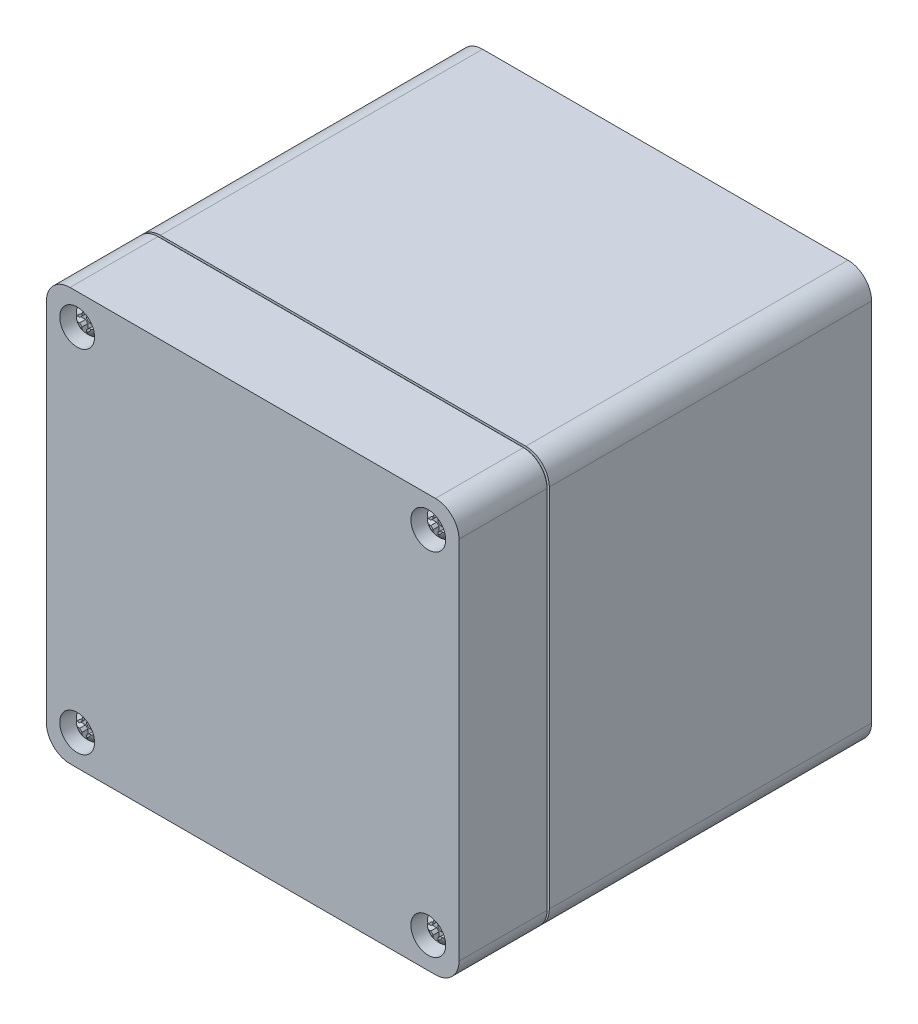
from build123d import *
from OCP.BRepFilletAPI import BRepFilletAPI_MakeChamfer

# Parameters (mm, degrees)
SKETCH3_W                    = 88.9
SKETCH3_H                    = 88.9
BOSS_EXTRUDE1_DEPTH          = 73.8886
CUT_EXTRUDE1_DEPTH           = 70.88886
FILLET1_R                    = 6.35
FILLET2_R                    = 2.54
SKETCH5_W                    = 88.9
SKETCH5_H                    = 88.9
CUT_EXTRUDE2_DEPTH           = 3.45186
SKETCH6_R                    = 2.804922
CUT_EXTRUDE3_DEPTH           = 95.408364787
CUT_EXTRUDE3_DRAFT           = 0.5
CUT_EXTRUDE3_PROFILE_2_DEPTH = 95.408364787
CUT_EXTRUDE3_PROFILE_2_DRAFT = 0.5
CUT_EXTRUDE3_PROFILE_3_DEPTH = 95.408364787
CUT_EXTRUDE3_PROFILE_3_DRAFT = 0.5
CUT_EXTRUDE3_PROFILE_4_DEPTH = 95.408364787
CUT_EXTRUDE3_PROFILE_4_DRAFT = 0.5
SKETCH9_R                    = 4.24942
CUT_EXTRUDE5_DEPTH           = 62.43574
CUT_EXTRUDE5_DRAFT           = -0.5
CUT_EXTRUDE5_PROFILE_2_DEPTH = 62.43574
CUT_EXTRUDE5_PROFILE_2_DRAFT = -0.5
CUT_EXTRUDE5_PROFILE_3_DEPTH = 62.43574
CUT_EXTRUDE5_PROFILE_3_DRAFT = -0.5
CUT_EXTRUDE5_PROFILE_4_DEPTH = 62.43574
CUT_EXTRUDE5_PROFILE_4_DRAFT = -0.5
SKETCH11_R                   = 1.6256
CUT_EXTRUDE6_DEPTH           = 95.408364787
CUT_EXTRUDE7_DEPTH           = 1.27
CHAMFER1_SIZE                = 0.508
FILLET5_R                    = 1.016
LPATTERN1_COUNT              = 2
LPATTERN1_PITCH              = 75.65644
LPATTERN1_2_COUNT            = 2
LPATTERN1_2_PITCH            = 75.65644
CUT_EXTRUDE8_DEPTH           = 67.437
SKETCH15_R                   = 1.5875
CUT_EXTRUDE9_DEPTH           = 106.190107314
MIRROR2_COPY_1_DEPTH         = 67.437
MIRROR2_COPY_2_SKETCH_R      = 1.5875
MIRROR2_COPY_2_DEPTH         = 106.190107314
SKETCH16_W                   = 88.9
SKETCH16_H                   = 88.9
SKETCH16_W_2                 = 87.95004
SKETCH16_H_2                 = 87.95004
CUT_EXTRUDE11_DEPTH          = 1.00076
FILLET3_R                    = 5.08
BOSS_EXTRUDE2_DEPTH          = 19.46402
CUT_EXTRUDE12_DEPTH          = 98.010979842
CUT_EXTRUDE12_DEPTH_BACK     = 98.010979842
SKETCH18_R                   = 1.75006
SKETCH19_R                   = 3.75031
CUT_EXTRUDE13_DEPTH          = 4.74726
CUT_EXTRUDE14_OUTLINE_R      = 1.75006
CUT_EXTRUDE14_DEPTH          = 13.70076
CUT_EXTRUDE14_TAPER          = -1
CUT_EXTRUDE14_2_OUTLINE_R    = 1.75006
CUT_EXTRUDE14_2_DEPTH        = 13.70076
CUT_EXTRUDE14_2_TAPER        = -1
CUT_EXTRUDE14_3_OUTLINE_R    = 1.75006
CUT_EXTRUDE14_3_DEPTH        = 13.70076
CUT_EXTRUDE14_3_TAPER        = -1
CUT_EXTRUDE14_4_OUTLINE_R    = 1.75006
CUT_EXTRUDE14_4_DEPTH        = 13.70076
CUT_EXTRUDE14_4_TAPER        = -1
CUT_EXTRUDE15_DEPTH          = 16.46428
CUT_EXTRUDE17_DEPTH          = 0.508
CUT_EXTRUDE18_DEPTH          = 15.95628
FILLET4_R                    = 0.508
CHAMFER2_SIZE                = 3.048
CHAMFER2_SIZE2               = 0.106438505
CHAMFER3_SIZE                = 3.048
CHAMFER3_SIZE2               = 0.106438505
SKETCH44_R                   = 7
CUT_EXTRUDE24_DEPTH          = 2.99974
SKETCH45_R                   = 2.5
BOSS_EXTRUDE5_DEPTH          = 45.40052
BOSS_EXTRUDE5_2_DEPTH        = 45.40052


with BuildPart() as part:
    # Sketch3 → Boss-Extrude1 (new body)
    with BuildSketch(Plane.XY):
        Rectangle(SKETCH3_W, SKETCH3_H)
    extrude(amount=-BOSS_EXTRUDE1_DEPTH)

    # Sketch4 → Cut-Extrude1 (cut)
    with BuildSketch(Plane.XY):
        Polygon((-41.45026, 21.95068), (-31.75, 21.95068), (-31.75, 41.45026), (31.75, 41.45026), (31.75, 21.95068), (41.45026, 21.95068), (41.45026, -21.95068), (31.75, -21.95068), (31.75, -41.45026), (-31.75, -41.45026), (-31.75, -21.95068), (-41.45026, -21.95068), align=None)
    extrude(amount=-CUT_EXTRUDE1_DEPTH, mode=Mode.SUBTRACT)

    # Fillet1
    fillet1_edges = [part.edges().sort_by_distance(p)[0] for p in [
        (-31.75, 21.95068, -35.44443),
        (31.75, 21.95068, -35.44443),
        (31.75, -21.95068, -35.44443),
        (-31.75, -21.95068, -35.44443),
    ]]
    fillet(fillet1_edges, radius=FILLET1_R)

    # Fillet2
    fillet2_edges = [part.edges().sort_by_distance(p)[0] for p in [
        (-41.45026, -21.95068, -35.44443),
        (-41.45026, 21.95068, -35.44443),
        (-31.75, 41.45026, -35.44443),
        (31.75, 41.45026, -35.44443),
        (41.45026, 21.95068, -35.44443),
        (41.45026, -21.95068, -35.44443),
        (31.75, -41.45026, -35.44443),
        (-31.75, -41.45026, -35.44443),
        (-41.45026, 0, -70.88886),
        (-39.77513, 21.95068, -70.88886),
        (0, 41.45026, -70.88886),
        (31.75, 34.87547, -70.88886),
        (41.45026, 0, -70.88886),
        (39.77513, -21.95068, -70.88886),
        (0, -41.45026, -70.88886),
        (-31.75, -34.87547, -70.88886),
        (39.77513, 21.95068, -70.88886),
        (31.75, -34.87547, -70.88886),
        (-39.77513, -21.95068, -70.88886),
        (-31.75, 34.87547, -70.88886),
        (33.609871939, 23.810551939, -70.88886),
        (33.609871939, -23.810551939, -70.88886),
        (-33.609871939, -23.810551939, -70.88886),
        (-33.609871939, 23.810551939, -70.88886),
    ]]
    fillet(fillet2_edges, radius=FILLET2_R)

    # Sketch5 → Cut-Extrude2 (cut)
    with BuildSketch(Plane.XY):
        Rectangle(SKETCH5_W, SKETCH5_H)
        with BuildLine():
            Line((33.24987, 28.30068), (33.24987, 38.91026))
            ThreePointArc((33.24987, 38.91026), (32.066619472, 41.766879472), (29.21, 42.95013))
            Line((29.21, 42.95013), (-29.21, 42.95013))
            ThreePointArc((-29.21, 42.95013), (-32.066619472, 41.766879472), (-33.24987, 38.91026))
            Line((-33.24987, 38.91026), (-33.24987, 28.30068))
            ThreePointArc((-33.24987, 28.30068), (-34.670440187, 24.871120187), (-38.1, 23.45055))
            Line((-38.1, 23.45055), (-38.91026, 23.45055))
            ThreePointArc((-38.91026, 23.45055), (-41.766879472, 22.267299472), (-42.95013, 19.41068))
            Line((-42.95013, 19.41068), (-42.95013, -19.41068))
            ThreePointArc((-42.95013, -19.41068), (-41.766879472, -22.267299472), (-38.91026, -23.45055))
            Line((-38.91026, -23.45055), (-38.1, -23.45055))
            ThreePointArc((-38.1, -23.45055), (-34.670440187, -24.871120187), (-33.24987, -28.30068))
            Line((-33.24987, -28.30068), (-33.24987, -38.91026))
            ThreePointArc((-33.24987, -38.91026), (-32.066619472, -41.766879472), (-29.21, -42.95013))
            Line((-29.21, -42.95013), (29.21, -42.95013))
            ThreePointArc((29.21, -42.95013), (32.066619472, -41.766879472), (33.24987, -38.91026))
            Line((33.24987, -38.91026), (33.24987, -28.30068))
            ThreePointArc((33.24987, -28.30068), (34.670440187, -24.871120187), (38.1, -23.45055))
            Line((38.1, -23.45055), (38.91026, -23.45055))
            ThreePointArc((38.91026, -23.45055), (41.766879472, -22.267299472), (42.95013, -19.41068))
            Line((42.95013, -19.41068), (42.95013, 19.41068))
            ThreePointArc((42.95013, 19.41068), (41.766879472, 22.267299472), (38.91026, 23.45055))
            Line((38.91026, 23.45055), (38.1, 23.45055))
            ThreePointArc((38.1, 23.45055), (34.670440187, 24.871120187), (33.24987, 28.30068))
        make_face(mode=Mode.SUBTRACT)
    extrude(amount=-CUT_EXTRUDE2_DEPTH, mode=Mode.SUBTRACT)


with BuildPart() as cut_extrude3_tool:
    # Sketch6 → Cut-Extrude3 (with draft: the straight prism first)
    with BuildSketch(Plane.XY.offset(-3.45186)):
        with Locations((37.82822, 37.82822)):
            Circle(SKETCH6_R)
    extrude(amount=-CUT_EXTRUDE3_DEPTH)
    # Cut-Extrude3: the draft: its side faces are tilted about the plane it starts from
    cut_extrude3_sides = [cut_extrude3_tool.faces().sort_by_distance(p)[0] for p in [
        (35.023298, 37.82822, -51.156042394),
    ]]
    draft(cut_extrude3_sides, Plane.XY.offset(-3.45186), CUT_EXTRUDE3_DRAFT)


with BuildPart() as part_1:
    add(part.part)

    # Cut-Extrude3: cut by cut_extrude3_tool
    add(cut_extrude3_tool.part, mode=Mode.SUBTRACT)


with BuildPart() as cut_extrude3_profile_2_tool:
    # Sketch6 → Cut-Extrude3 profile 2 (with draft: the straight prism first)
    with BuildSketch(Plane.XY.offset(-3.45186)):
        with Locations((-37.82822, 37.82822)):
            Circle(SKETCH6_R)
    extrude(amount=-CUT_EXTRUDE3_PROFILE_2_DEPTH)
    # Cut-Extrude3 profile 2: the draft: its side faces are tilted about the plane it starts from
    cut_extrude3_profile_2_sides = [cut_extrude3_profile_2_tool.faces().sort_by_distance(p)[0] for p in [
        (-40.633142, 37.82822, -51.156042394),
    ]]
    draft(cut_extrude3_profile_2_sides, Plane.XY.offset(-3.45186), CUT_EXTRUDE3_PROFILE_2_DRAFT)


with BuildPart() as part_2:
    add(part_1.part)

    # Cut-Extrude3 profile 2: cut by cut_extrude3_profile_2_tool
    add(cut_extrude3_profile_2_tool.part, mode=Mode.SUBTRACT)


with BuildPart() as cut_extrude3_profile_3_tool:
    # Sketch6 → Cut-Extrude3 profile 3 (with draft: the straight prism first)
    with BuildSketch(Plane.XY.offset(-3.45186)):
        with Locations((-37.82822, -37.82822)):
            Circle(SKETCH6_R)
    extrude(amount=-CUT_EXTRUDE3_PROFILE_3_DEPTH)
    # Cut-Extrude3 profile 3: the draft: its side faces are tilted about the plane it starts from
    cut_extrude3_profile_3_sides = [cut_extrude3_profile_3_tool.faces().sort_by_distance(p)[0] for p in [
        (-40.633142, -37.82822, -51.156042394),
    ]]
    draft(cut_extrude3_profile_3_sides, Plane.XY.offset(-3.45186), CUT_EXTRUDE3_PROFILE_3_DRAFT)


with BuildPart() as part_3:
    add(part_2.part)

    # Cut-Extrude3 profile 3: cut by cut_extrude3_profile_3_tool
    add(cut_extrude3_profile_3_tool.part, mode=Mode.SUBTRACT)


with BuildPart() as cut_extrude3_profile_4_tool:
    # Sketch6 → Cut-Extrude3 profile 4 (with draft: the straight prism first)
    with BuildSketch(Plane.XY.offset(-3.45186)):
        with Locations((37.82822, -37.82822)):
            Circle(SKETCH6_R)
    extrude(amount=-CUT_EXTRUDE3_PROFILE_4_DEPTH)
    # Cut-Extrude3 profile 4: the draft: its side faces are tilted about the plane it starts from
    cut_extrude3_profile_4_sides = [cut_extrude3_profile_4_tool.faces().sort_by_distance(p)[0] for p in [
        (35.023298, -37.82822, -51.156042394),
    ]]
    draft(cut_extrude3_profile_4_sides, Plane.XY.offset(-3.45186), CUT_EXTRUDE3_PROFILE_4_DRAFT)


with BuildPart() as part_4:
    add(part_3.part)

    # Cut-Extrude3 profile 4: cut by cut_extrude3_profile_4_tool
    add(cut_extrude3_profile_4_tool.part, mode=Mode.SUBTRACT)


with BuildPart() as cut_extrude5_tool:
    # Sketch9 → Cut-Extrude5 (with draft: the straight prism first)
    with BuildSketch(Plane(origin=(0, 0, -73.8886), x_dir=(-1, 0, 0), z_dir=(0, 0, -1))):
        with Locations((-37.82822, 37.82822)):
            Circle(SKETCH9_R)
    extrude(amount=-CUT_EXTRUDE5_DEPTH)
    # Cut-Extrude5: the draft: its side faces are tilted about the plane it starts from
    cut_extrude5_sides = [cut_extrude5_tool.faces().sort_by_distance(p)[0] for p in [
        (42.07764, 37.82822, -42.67073),
    ]]
    draft(cut_extrude5_sides, Plane(origin=(0, 0, -73.8886), x_dir=(-1, 0, 0), z_dir=(0, 0, -1)), CUT_EXTRUDE5_DRAFT)


with BuildPart() as part_5:
    add(part_4.part)

    # Cut-Extrude5: cut by cut_extrude5_tool
    add(cut_extrude5_tool.part, mode=Mode.SUBTRACT)


with BuildPart() as cut_extrude5_profile_2_tool:
    # Sketch9 → Cut-Extrude5 profile 2 (with draft: the straight prism first)
    with BuildSketch(Plane(origin=(0, 0, -73.8886), x_dir=(-1, 0, 0), z_dir=(0, 0, -1))):
        with Locations((37.82822, 37.82822)):
            Circle(SKETCH9_R)
    extrude(amount=-CUT_EXTRUDE5_PROFILE_2_DEPTH)
    # Cut-Extrude5 profile 2: the draft: its side faces are tilted about the plane it starts from
    cut_extrude5_profile_2_sides = [cut_extrude5_profile_2_tool.faces().sort_by_distance(p)[0] for p in [
        (-33.5788, 37.82822, -42.67073),
    ]]
    draft(cut_extrude5_profile_2_sides, Plane(origin=(0, 0, -73.8886), x_dir=(-1, 0, 0), z_dir=(0, 0, -1)), CUT_EXTRUDE5_PROFILE_2_DRAFT)


with BuildPart() as part_6:
    add(part_5.part)

    # Cut-Extrude5 profile 2: cut by cut_extrude5_profile_2_tool
    add(cut_extrude5_profile_2_tool.part, mode=Mode.SUBTRACT)


with BuildPart() as cut_extrude5_profile_3_tool:
    # Sketch9 → Cut-Extrude5 profile 3 (with draft: the straight prism first)
    with BuildSketch(Plane(origin=(0, 0, -73.8886), x_dir=(-1, 0, 0), z_dir=(0, 0, -1))):
        with Locations((37.82822, -37.82822)):
            Circle(SKETCH9_R)
    extrude(amount=-CUT_EXTRUDE5_PROFILE_3_DEPTH)
    # Cut-Extrude5 profile 3: the draft: its side faces are tilted about the plane it starts from
    cut_extrude5_profile_3_sides = [cut_extrude5_profile_3_tool.faces().sort_by_distance(p)[0] for p in [
        (-33.5788, -37.82822, -42.67073),
    ]]
    draft(cut_extrude5_profile_3_sides, Plane(origin=(0, 0, -73.8886), x_dir=(-1, 0, 0), z_dir=(0, 0, -1)), CUT_EXTRUDE5_PROFILE_3_DRAFT)


with BuildPart() as part_7:
    add(part_6.part)

    # Cut-Extrude5 profile 3: cut by cut_extrude5_profile_3_tool
    add(cut_extrude5_profile_3_tool.part, mode=Mode.SUBTRACT)


with BuildPart() as cut_extrude5_profile_4_tool:
    # Sketch9 → Cut-Extrude5 profile 4 (with draft: the straight prism first)
    with BuildSketch(Plane(origin=(0, 0, -73.8886), x_dir=(-1, 0, 0), z_dir=(0, 0, -1))):
        with Locations((-37.82822, -37.82822)):
            Circle(SKETCH9_R)
    extrude(amount=-CUT_EXTRUDE5_PROFILE_4_DEPTH)
    # Cut-Extrude5 profile 4: the draft: its side faces are tilted about the plane it starts from
    cut_extrude5_profile_4_sides = [cut_extrude5_profile_4_tool.faces().sort_by_distance(p)[0] for p in [
        (42.07764, -37.82822, -42.67073),
    ]]
    draft(cut_extrude5_profile_4_sides, Plane(origin=(0, 0, -73.8886), x_dir=(-1, 0, 0), z_dir=(0, 0, -1)), CUT_EXTRUDE5_PROFILE_4_DRAFT)


with BuildPart() as part_8:
    add(part_7.part)

    # Cut-Extrude5 profile 4: cut by cut_extrude5_profile_4_tool
    add(cut_extrude5_profile_4_tool.part, mode=Mode.SUBTRACT)

    # Sketch14 → Cut-Extrude8 (cut)
    with BuildSketch(Plane.XY.offset(-3.45186)):
        with BuildLine():
            Line((-41.45026, 33.02), (-34.0233, 33.02))
            ThreePointArc((-34.0233, 33.02), (-33.484484633, 32.796815367), (-33.2613, 32.258))
            Line((-33.2613, 32.258), (-33.2613, 29.21))
            ThreePointArc((-33.2613, 29.21), (-34.749197552, 25.617897552), (-38.3413, 24.13))
            Line((-38.3413, 24.13), (-41.45026, 24.13))
            Line((-41.45026, 24.13), (-41.45026, 33.02))
        make_face()
    cut_extrude8 = extrude(amount=-CUT_EXTRUDE8_DEPTH, mode=Mode.SUBTRACT)

    # Sketch15 → Cut-Extrude9 (cut, through all)
    with BuildSketch(Plane.XY.offset(-70.88886)):
        with Locations((-38.1, 28.30068)):
            Circle(SKETCH15_R)
    cut_extrude9 = extrude(amount=-CUT_EXTRUDE9_DEPTH, mode=Mode.SUBTRACT)

    # Mirror1: Cut-Extrude8, Cut-Extrude9 across plane
    add(cut_extrude8.mirror(Plane(origin=(0, 0, 0), x_dir=(0, 0, 1), z_dir=(1, 0, 0))), mode=Mode.SUBTRACT)
    add(cut_extrude9.mirror(Plane(origin=(0, 0, 0), x_dir=(0, 0, 1), z_dir=(1, 0, 0))), mode=Mode.SUBTRACT)

    # Mirror2: Cut-Extrude8, Cut-Extrude9 across plane
    add(cut_extrude8.mirror(Plane.ZX), mode=Mode.SUBTRACT)
    add(cut_extrude9.mirror(Plane.ZX), mode=Mode.SUBTRACT)

    # Mirror2 copy 1 sketch → Mirror2 copy 1 (cut)
    with BuildSketch(Plane(origin=(0, 0, -3.45186), x_dir=(-1, 0, 0), z_dir=(0, 0, 1))):
        with BuildLine():
            Line((-41.45026, 33.02), (-34.0233, 33.02))
            ThreePointArc((-34.0233, 33.02), (-33.484484633, 32.796815367), (-33.2613, 32.258))
            Line((-33.2613, 32.258), (-33.2613, 29.21))
            ThreePointArc((-33.2613, 29.21), (-34.749197552, 25.617897552), (-38.3413, 24.13))
            Line((-38.3413, 24.13), (-41.45026, 24.13))
            Line((-41.45026, 24.13), (-41.45026, 33.02))
        make_face()
    extrude(amount=-MIRROR2_COPY_1_DEPTH, mode=Mode.SUBTRACT)

    # Mirror2 copy 2 sketch → Mirror2 copy 2 (cut, through all)
    with BuildSketch(Plane(origin=(0, 0, -70.88886), x_dir=(-1, 0, 0), z_dir=(0, 0, 1))):
        with Locations((-38.1, 28.30068)):
            Circle(MIRROR2_COPY_2_SKETCH_R)
    extrude(amount=-MIRROR2_COPY_2_DEPTH, mode=Mode.SUBTRACT)

    # Sketch16 → Cut-Extrude11 (cut)
    with BuildSketch(Plane.XY.offset(-3.45186)):
        Rectangle(SKETCH16_W, SKETCH16_H)
        Rectangle(SKETCH16_W_2, SKETCH16_H_2, mode=Mode.SUBTRACT)
    extrude(amount=-CUT_EXTRUDE11_DEPTH, mode=Mode.SUBTRACT)

    # Fillet3
    fillet3_edges = [part_8.edges().sort_by_distance(p)[0] for p in [
        (43.97502, -43.97502, -3.95224),
        (-43.97502, -43.97502, -3.95224),
        (-43.97502, 43.97502, -3.95224),
        (43.97502, 43.97502, -3.95224),
        (-44.45, 44.45, -39.17061),
        (44.45, 44.45, -39.17061),
        (44.45, -44.45, -39.17061),
        (-44.45, -44.45, -39.17061),
    ]]
    fillet(fillet3_edges, radius=FILLET3_R)

    # Chamfer2: one chamfer whose edges measure the first distance from different faces: ONE call of the kernel's chamfer builder (chamfer() names one face for all edges)
    chamfer2_edges_1 = [part_8.edges().sort_by_distance(p)[0] for p in [
        (34.670440187, 24.871120187, 0),
    ]]
    chamfer2_side_1 = [part_8.faces().sort_by_distance(p)[0] for p in [
        (34.670440187, 24.871120187, -1.72593),
    ]]
    chamfer2_edges_2 = [part_8.edges().sort_by_distance(p)[0] for p in [
        (38.50513, 23.45055, 0),
    ]]
    chamfer2_side_2 = [part_8.faces().sort_by_distance(p)[0] for p in [
        (38.50513, 23.45055, -1.72593),
    ]]
    chamfer2_edges_3 = [part_8.edges().sort_by_distance(p)[0] for p in [
        (41.766879472, 22.267299472, 0),
    ]]
    chamfer2_side_3 = [part_8.faces().sort_by_distance(p)[0] for p in [
        (41.766879472, 22.267299472, -1.72593),
    ]]
    chamfer2_edges_4 = [part_8.edges().sort_by_distance(p)[0] for p in [
        (42.95013, 0, 0),
    ]]
    chamfer2_side_4 = [part_8.faces().sort_by_distance(p)[0] for p in [
        (42.95013, 0, -1.72593),
    ]]
    chamfer2_edges_5 = [part_8.edges().sort_by_distance(p)[0] for p in [
        (41.766879472, -22.267299472, 0),
    ]]
    chamfer2_side_5 = [part_8.faces().sort_by_distance(p)[0] for p in [
        (41.766879472, -22.267299472, -1.72593),
    ]]
    chamfer2_edges_6 = [part_8.edges().sort_by_distance(p)[0] for p in [
        (38.50513, -23.45055, 0),
    ]]
    chamfer2_side_6 = [part_8.faces().sort_by_distance(p)[0] for p in [
        (38.50513, -23.45055, -1.72593),
    ]]
    chamfer2_edges_7 = [part_8.edges().sort_by_distance(p)[0] for p in [
        (34.670440187, -24.871120187, 0),
    ]]
    chamfer2_side_7 = [part_8.faces().sort_by_distance(p)[0] for p in [
        (34.670440187, -24.871120187, -1.72593),
    ]]
    chamfer2_edges_8 = [part_8.edges().sort_by_distance(p)[0] for p in [
        (33.24987, -33.60547, 0),
    ]]
    chamfer2_side_8 = [part_8.faces().sort_by_distance(p)[0] for p in [
        (33.24987, -33.60547, -1.72593),
    ]]
    chamfer2_edges_9 = [part_8.edges().sort_by_distance(p)[0] for p in [
        (32.066619472, -41.766879472, 0),
    ]]
    chamfer2_side_9 = [part_8.faces().sort_by_distance(p)[0] for p in [
        (32.066619472, -41.766879472, -1.72593),
    ]]
    chamfer2_edges_10 = [part_8.edges().sort_by_distance(p)[0] for p in [
        (0, -42.95013, 0),
    ]]
    chamfer2_side_10 = [part_8.faces().sort_by_distance(p)[0] for p in [
        (0, -42.95013, -1.72593),
    ]]
    chamfer2_edges_11 = [part_8.edges().sort_by_distance(p)[0] for p in [
        (-32.066619472, -41.766879472, 0),
    ]]
    chamfer2_side_11 = [part_8.faces().sort_by_distance(p)[0] for p in [
        (-32.066619472, -41.766879472, -1.72593),
    ]]
    chamfer2_edges_12 = [part_8.edges().sort_by_distance(p)[0] for p in [
        (-33.24987, -33.60547, 0),
    ]]
    chamfer2_side_12 = [part_8.faces().sort_by_distance(p)[0] for p in [
        (-33.24987, -33.60547, -1.72593),
    ]]
    chamfer2_edges_13 = [part_8.edges().sort_by_distance(p)[0] for p in [
        (-34.670440187, -24.871120187, 0),
    ]]
    chamfer2_side_13 = [part_8.faces().sort_by_distance(p)[0] for p in [
        (-34.670440187, -24.871120187, -1.72593),
    ]]
    chamfer2_edges_14 = [part_8.edges().sort_by_distance(p)[0] for p in [
        (-38.50513, -23.45055, 0),
    ]]
    chamfer2_side_14 = [part_8.faces().sort_by_distance(p)[0] for p in [
        (-38.50513, -23.45055, -1.72593),
    ]]
    chamfer2_edges_15 = [part_8.edges().sort_by_distance(p)[0] for p in [
        (-41.766879472, -22.267299472, 0),
    ]]
    chamfer2_side_15 = [part_8.faces().sort_by_distance(p)[0] for p in [
        (-41.766879472, -22.267299472, -1.72593),
    ]]
    chamfer2_edges_16 = [part_8.edges().sort_by_distance(p)[0] for p in [
        (-42.95013, 0, 0),
    ]]
    chamfer2_side_16 = [part_8.faces().sort_by_distance(p)[0] for p in [
        (-42.95013, 0, -1.72593),
    ]]
    chamfer2_edges_17 = [part_8.edges().sort_by_distance(p)[0] for p in [
        (-41.766879472, 22.267299472, 0),
    ]]
    chamfer2_side_17 = [part_8.faces().sort_by_distance(p)[0] for p in [
        (-41.766879472, 22.267299472, -1.72593),
    ]]
    chamfer2_edges_18 = [part_8.edges().sort_by_distance(p)[0] for p in [
        (-38.50513, 23.45055, 0),
    ]]
    chamfer2_side_18 = [part_8.faces().sort_by_distance(p)[0] for p in [
        (-38.50513, 23.45055, -1.72593),
    ]]
    chamfer2_edges_19 = [part_8.edges().sort_by_distance(p)[0] for p in [
        (-34.670440187, 24.871120187, 0),
    ]]
    chamfer2_side_19 = [part_8.faces().sort_by_distance(p)[0] for p in [
        (-34.670440187, 24.871120187, -1.72593),
    ]]
    chamfer2_edges_20 = [part_8.edges().sort_by_distance(p)[0] for p in [
        (-33.24987, 33.60547, 0),
    ]]
    chamfer2_side_20 = [part_8.faces().sort_by_distance(p)[0] for p in [
        (-33.24987, 33.60547, -1.72593),
    ]]
    chamfer2_edges_21 = [part_8.edges().sort_by_distance(p)[0] for p in [
        (-32.066619472, 41.766879472, 0),
    ]]
    chamfer2_side_21 = [part_8.faces().sort_by_distance(p)[0] for p in [
        (-32.066619472, 41.766879472, -1.72593),
    ]]
    chamfer2_edges_22 = [part_8.edges().sort_by_distance(p)[0] for p in [
        (0, 42.95013, 0),
    ]]
    chamfer2_side_22 = [part_8.faces().sort_by_distance(p)[0] for p in [
        (0, 42.95013, -1.72593),
    ]]
    chamfer2_edges_23 = [part_8.edges().sort_by_distance(p)[0] for p in [
        (32.066619472, 41.766879472, 0),
    ]]
    chamfer2_side_23 = [part_8.faces().sort_by_distance(p)[0] for p in [
        (32.066619472, 41.766879472, -1.72593),
    ]]
    chamfer2_edges_24 = [part_8.edges().sort_by_distance(p)[0] for p in [
        (33.24987, 33.60547, 0),
    ]]
    chamfer2_side_24 = [part_8.faces().sort_by_distance(p)[0] for p in [
        (33.24987, 33.60547, -1.72593),
    ]]
    chamfer2 = BRepFilletAPI_MakeChamfer(part_8.part.solid().wrapped)
    for e in chamfer2_edges_1:
        chamfer2.Add(CHAMFER2_SIZE, CHAMFER2_SIZE2, e.wrapped, chamfer2_side_1[0].wrapped)  # the first distance lies on this face
    for e in chamfer2_edges_2:
        chamfer2.Add(CHAMFER2_SIZE, CHAMFER2_SIZE2, e.wrapped, chamfer2_side_2[0].wrapped)  # the first distance lies on this face
    for e in chamfer2_edges_3:
        chamfer2.Add(CHAMFER2_SIZE, CHAMFER2_SIZE2, e.wrapped, chamfer2_side_3[0].wrapped)  # the first distance lies on this face
    for e in chamfer2_edges_4:
        chamfer2.Add(CHAMFER2_SIZE, CHAMFER2_SIZE2, e.wrapped, chamfer2_side_4[0].wrapped)  # the first distance lies on this face
    for e in chamfer2_edges_5:
        chamfer2.Add(CHAMFER2_SIZE, CHAMFER2_SIZE2, e.wrapped, chamfer2_side_5[0].wrapped)  # the first distance lies on this face
    for e in chamfer2_edges_6:
        chamfer2.Add(CHAMFER2_SIZE, CHAMFER2_SIZE2, e.wrapped, chamfer2_side_6[0].wrapped)  # the first distance lies on this face
    for e in chamfer2_edges_7:
        chamfer2.Add(CHAMFER2_SIZE, CHAMFER2_SIZE2, e.wrapped, chamfer2_side_7[0].wrapped)  # the first distance lies on this face
    for e in chamfer2_edges_8:
        chamfer2.Add(CHAMFER2_SIZE, CHAMFER2_SIZE2, e.wrapped, chamfer2_side_8[0].wrapped)  # the first distance lies on this face
    for e in chamfer2_edges_9:
        chamfer2.Add(CHAMFER2_SIZE, CHAMFER2_SIZE2, e.wrapped, chamfer2_side_9[0].wrapped)  # the first distance lies on this face
    for e in chamfer2_edges_10:
        chamfer2.Add(CHAMFER2_SIZE, CHAMFER2_SIZE2, e.wrapped, chamfer2_side_10[0].wrapped)  # the first distance lies on this face
    for e in chamfer2_edges_11:
        chamfer2.Add(CHAMFER2_SIZE, CHAMFER2_SIZE2, e.wrapped, chamfer2_side_11[0].wrapped)  # the first distance lies on this face
    for e in chamfer2_edges_12:
        chamfer2.Add(CHAMFER2_SIZE, CHAMFER2_SIZE2, e.wrapped, chamfer2_side_12[0].wrapped)  # the first distance lies on this face
    for e in chamfer2_edges_13:
        chamfer2.Add(CHAMFER2_SIZE, CHAMFER2_SIZE2, e.wrapped, chamfer2_side_13[0].wrapped)  # the first distance lies on this face
    for e in chamfer2_edges_14:
        chamfer2.Add(CHAMFER2_SIZE, CHAMFER2_SIZE2, e.wrapped, chamfer2_side_14[0].wrapped)  # the first distance lies on this face
    for e in chamfer2_edges_15:
        chamfer2.Add(CHAMFER2_SIZE, CHAMFER2_SIZE2, e.wrapped, chamfer2_side_15[0].wrapped)  # the first distance lies on this face
    for e in chamfer2_edges_16:
        chamfer2.Add(CHAMFER2_SIZE, CHAMFER2_SIZE2, e.wrapped, chamfer2_side_16[0].wrapped)  # the first distance lies on this face
    for e in chamfer2_edges_17:
        chamfer2.Add(CHAMFER2_SIZE, CHAMFER2_SIZE2, e.wrapped, chamfer2_side_17[0].wrapped)  # the first distance lies on this face
    for e in chamfer2_edges_18:
        chamfer2.Add(CHAMFER2_SIZE, CHAMFER2_SIZE2, e.wrapped, chamfer2_side_18[0].wrapped)  # the first distance lies on this face
    for e in chamfer2_edges_19:
        chamfer2.Add(CHAMFER2_SIZE, CHAMFER2_SIZE2, e.wrapped, chamfer2_side_19[0].wrapped)  # the first distance lies on this face
    for e in chamfer2_edges_20:
        chamfer2.Add(CHAMFER2_SIZE, CHAMFER2_SIZE2, e.wrapped, chamfer2_side_20[0].wrapped)  # the first distance lies on this face
    for e in chamfer2_edges_21:
        chamfer2.Add(CHAMFER2_SIZE, CHAMFER2_SIZE2, e.wrapped, chamfer2_side_21[0].wrapped)  # the first distance lies on this face
    for e in chamfer2_edges_22:
        chamfer2.Add(CHAMFER2_SIZE, CHAMFER2_SIZE2, e.wrapped, chamfer2_side_22[0].wrapped)  # the first distance lies on this face
    for e in chamfer2_edges_23:
        chamfer2.Add(CHAMFER2_SIZE, CHAMFER2_SIZE2, e.wrapped, chamfer2_side_23[0].wrapped)  # the first distance lies on this face
    for e in chamfer2_edges_24:
        chamfer2.Add(CHAMFER2_SIZE, CHAMFER2_SIZE2, e.wrapped, chamfer2_side_24[0].wrapped)  # the first distance lies on this face
    add(Compound.cast(chamfer2.Shape()), mode=Mode.REPLACE)

    # Chamfer3: one chamfer whose edges measure the first distance from different faces: ONE call of the kernel's chamfer builder (chamfer() names one face for all edges)
    chamfer3_edges_1 = [part_8.edges().sort_by_distance(p)[0] for p in [
        (31.006051224, -40.706311224, 0),
    ]]
    chamfer3_side_1 = [part_8.faces().sort_by_distance(p)[0] for p in [
        (31.006051224, -40.706311224, -34.17443),
    ]]
    chamfer3_edges_2 = [part_8.edges().sort_by_distance(p)[0] for p in [
        (-31.006051224, -40.706311224, 0),
    ]]
    chamfer3_side_2 = [part_8.faces().sort_by_distance(p)[0] for p in [
        (-31.006051224, -40.706311224, -34.17443),
    ]]
    chamfer3_edges_3 = [part_8.edges().sort_by_distance(p)[0] for p in [
        (-40.706311224, -21.206731224, 0),
    ]]
    chamfer3_side_3 = [part_8.faces().sort_by_distance(p)[0] for p in [
        (-40.706311224, -21.206731224, -34.17443),
    ]]
    chamfer3_edges_4 = [part_8.edges().sort_by_distance(p)[0] for p in [
        (-40.706311224, 21.206731224, 0),
    ]]
    chamfer3_side_4 = [part_8.faces().sort_by_distance(p)[0] for p in [
        (-40.706311224, 21.206731224, -34.17443),
    ]]
    chamfer3_edges_5 = [part_8.edges().sort_by_distance(p)[0] for p in [
        (-31.006051224, 40.706311224, 0),
    ]]
    chamfer3_side_5 = [part_8.faces().sort_by_distance(p)[0] for p in [
        (-31.006051224, 40.706311224, -34.17443),
    ]]
    chamfer3_edges_6 = [part_8.edges().sort_by_distance(p)[0] for p in [
        (31.006051224, 40.706311224, 0),
    ]]
    chamfer3_side_6 = [part_8.faces().sort_by_distance(p)[0] for p in [
        (31.006051224, 40.706311224, -34.17443),
    ]]
    chamfer3_edges_7 = [part_8.edges().sort_by_distance(p)[0] for p in [
        (40.706311224, 21.206731224, 0),
    ]]
    chamfer3_side_7 = [part_8.faces().sort_by_distance(p)[0] for p in [
        (40.706311224, 21.206731224, -34.17443),
    ]]
    chamfer3_edges_8 = [part_8.edges().sort_by_distance(p)[0] for p in [
        (40.706311224, -21.206731224, 0),
    ]]
    chamfer3_side_8 = [part_8.faces().sort_by_distance(p)[0] for p in [
        (40.706311224, -21.206731224, -34.17443),
    ]]
    chamfer3_edges_9 = [part_8.edges().sort_by_distance(p)[0] for p in [
        (31.75, 33.60547, 0),
    ]]
    chamfer3_side_9 = [part_8.faces().sort_by_distance(p)[0] for p in [
        (31.75, 33.60547, -34.17443),
    ]]
    chamfer3_edges_10 = [part_8.edges().sort_by_distance(p)[0] for p in [
        (-38.50513, 21.95068, 0),
    ]]
    chamfer3_side_10 = [part_8.faces().sort_by_distance(p)[0] for p in [
        (-38.50513, 21.95068, -34.17443),
    ]]
    chamfer3_edges_11 = [part_8.edges().sort_by_distance(p)[0] for p in [
        (38.50513, -21.95068, 0),
    ]]
    chamfer3_side_11 = [part_8.faces().sort_by_distance(p)[0] for p in [
        (38.50513, -21.95068, -34.17443),
    ]]
    chamfer3_edges_12 = [part_8.edges().sort_by_distance(p)[0] for p in [
        (-31.75, -33.60547, 0),
    ]]
    chamfer3_side_12 = [part_8.faces().sort_by_distance(p)[0] for p in [
        (-31.75, -33.60547, -34.17443),
    ]]
    chamfer3_edges_13 = [part_8.edges().sort_by_distance(p)[0] for p in [
        (-33.609871939, 23.810551939, 0),
    ]]
    chamfer3_side_13 = [part_8.faces().sort_by_distance(p)[0] for p in [
        (-33.609871939, 23.810551939, -34.17443),
    ]]
    chamfer3_edges_14 = [part_8.edges().sort_by_distance(p)[0] for p in [
        (-33.609871939, -23.810551939, 0),
    ]]
    chamfer3_side_14 = [part_8.faces().sort_by_distance(p)[0] for p in [
        (-33.609871939, -23.810551939, -34.17443),
    ]]
    chamfer3_edges_15 = [part_8.edges().sort_by_distance(p)[0] for p in [
        (33.609871939, -23.810551939, 0),
    ]]
    chamfer3_side_15 = [part_8.faces().sort_by_distance(p)[0] for p in [
        (33.609871939, -23.810551939, -34.17443),
    ]]
    chamfer3_edges_16 = [part_8.edges().sort_by_distance(p)[0] for p in [
        (33.609871939, 23.810551939, 0),
    ]]
    chamfer3_side_16 = [part_8.faces().sort_by_distance(p)[0] for p in [
        (33.609871939, 23.810551939, -34.17443),
    ]]
    chamfer3_edges_17 = [part_8.edges().sort_by_distance(p)[0] for p in [
        (-31.75, 33.60547, 0),
    ]]
    chamfer3_side_17 = [part_8.faces().sort_by_distance(p)[0] for p in [
        (-31.75, 33.60547, -34.17443),
    ]]
    chamfer3_edges_18 = [part_8.edges().sort_by_distance(p)[0] for p in [
        (0, 41.45026, 0),
    ]]
    chamfer3_side_18 = [part_8.faces().sort_by_distance(p)[0] for p in [
        (0, 41.45026, -34.17443),
    ]]
    chamfer3_edges_19 = [part_8.edges().sort_by_distance(p)[0] for p in [
        (38.50513, 21.95068, 0),
    ]]
    chamfer3_side_19 = [part_8.faces().sort_by_distance(p)[0] for p in [
        (38.50513, 21.95068, -34.17443),
    ]]
    chamfer3_edges_20 = [part_8.edges().sort_by_distance(p)[0] for p in [
        (41.45026, 0, 0),
    ]]
    chamfer3_side_20 = [part_8.faces().sort_by_distance(p)[0] for p in [
        (41.45026, 0, -34.17443),
    ]]
    chamfer3_edges_21 = [part_8.edges().sort_by_distance(p)[0] for p in [
        (31.75, -33.60547, 0),
    ]]
    chamfer3_side_21 = [part_8.faces().sort_by_distance(p)[0] for p in [
        (31.75, -33.60547, -34.17443),
    ]]
    chamfer3_edges_22 = [part_8.edges().sort_by_distance(p)[0] for p in [
        (0, -41.45026, 0),
    ]]
    chamfer3_side_22 = [part_8.faces().sort_by_distance(p)[0] for p in [
        (0, -41.45026, -34.17443),
    ]]
    chamfer3_edges_23 = [part_8.edges().sort_by_distance(p)[0] for p in [
        (-38.50513, -21.95068, 0),
    ]]
    chamfer3_side_23 = [part_8.faces().sort_by_distance(p)[0] for p in [
        (-38.50513, -21.95068, -34.17443),
    ]]
    chamfer3_edges_24 = [part_8.edges().sort_by_distance(p)[0] for p in [
        (-41.45026, 0, 0),
    ]]
    chamfer3_side_24 = [part_8.faces().sort_by_distance(p)[0] for p in [
        (-41.45026, 0, -34.17443),
    ]]
    chamfer3 = BRepFilletAPI_MakeChamfer(part_8.part.solid().wrapped)
    for e in chamfer3_edges_1:
        chamfer3.Add(CHAMFER3_SIZE, CHAMFER3_SIZE2, e.wrapped, chamfer3_side_1[0].wrapped)  # the first distance lies on this face
    for e in chamfer3_edges_2:
        chamfer3.Add(CHAMFER3_SIZE, CHAMFER3_SIZE2, e.wrapped, chamfer3_side_2[0].wrapped)  # the first distance lies on this face
    for e in chamfer3_edges_3:
        chamfer3.Add(CHAMFER3_SIZE, CHAMFER3_SIZE2, e.wrapped, chamfer3_side_3[0].wrapped)  # the first distance lies on this face
    for e in chamfer3_edges_4:
        chamfer3.Add(CHAMFER3_SIZE, CHAMFER3_SIZE2, e.wrapped, chamfer3_side_4[0].wrapped)  # the first distance lies on this face
    for e in chamfer3_edges_5:
        chamfer3.Add(CHAMFER3_SIZE, CHAMFER3_SIZE2, e.wrapped, chamfer3_side_5[0].wrapped)  # the first distance lies on this face
    for e in chamfer3_edges_6:
        chamfer3.Add(CHAMFER3_SIZE, CHAMFER3_SIZE2, e.wrapped, chamfer3_side_6[0].wrapped)  # the first distance lies on this face
    for e in chamfer3_edges_7:
        chamfer3.Add(CHAMFER3_SIZE, CHAMFER3_SIZE2, e.wrapped, chamfer3_side_7[0].wrapped)  # the first distance lies on this face
    for e in chamfer3_edges_8:
        chamfer3.Add(CHAMFER3_SIZE, CHAMFER3_SIZE2, e.wrapped, chamfer3_side_8[0].wrapped)  # the first distance lies on this face
    for e in chamfer3_edges_9:
        chamfer3.Add(CHAMFER3_SIZE, CHAMFER3_SIZE2, e.wrapped, chamfer3_side_9[0].wrapped)  # the first distance lies on this face
    for e in chamfer3_edges_10:
        chamfer3.Add(CHAMFER3_SIZE, CHAMFER3_SIZE2, e.wrapped, chamfer3_side_10[0].wrapped)  # the first distance lies on this face
    for e in chamfer3_edges_11:
        chamfer3.Add(CHAMFER3_SIZE, CHAMFER3_SIZE2, e.wrapped, chamfer3_side_11[0].wrapped)  # the first distance lies on this face
    for e in chamfer3_edges_12:
        chamfer3.Add(CHAMFER3_SIZE, CHAMFER3_SIZE2, e.wrapped, chamfer3_side_12[0].wrapped)  # the first distance lies on this face
    for e in chamfer3_edges_13:
        chamfer3.Add(CHAMFER3_SIZE, CHAMFER3_SIZE2, e.wrapped, chamfer3_side_13[0].wrapped)  # the first distance lies on this face
    for e in chamfer3_edges_14:
        chamfer3.Add(CHAMFER3_SIZE, CHAMFER3_SIZE2, e.wrapped, chamfer3_side_14[0].wrapped)  # the first distance lies on this face
    for e in chamfer3_edges_15:
        chamfer3.Add(CHAMFER3_SIZE, CHAMFER3_SIZE2, e.wrapped, chamfer3_side_15[0].wrapped)  # the first distance lies on this face
    for e in chamfer3_edges_16:
        chamfer3.Add(CHAMFER3_SIZE, CHAMFER3_SIZE2, e.wrapped, chamfer3_side_16[0].wrapped)  # the first distance lies on this face
    for e in chamfer3_edges_17:
        chamfer3.Add(CHAMFER3_SIZE, CHAMFER3_SIZE2, e.wrapped, chamfer3_side_17[0].wrapped)  # the first distance lies on this face
    for e in chamfer3_edges_18:
        chamfer3.Add(CHAMFER3_SIZE, CHAMFER3_SIZE2, e.wrapped, chamfer3_side_18[0].wrapped)  # the first distance lies on this face
    for e in chamfer3_edges_19:
        chamfer3.Add(CHAMFER3_SIZE, CHAMFER3_SIZE2, e.wrapped, chamfer3_side_19[0].wrapped)  # the first distance lies on this face
    for e in chamfer3_edges_20:
        chamfer3.Add(CHAMFER3_SIZE, CHAMFER3_SIZE2, e.wrapped, chamfer3_side_20[0].wrapped)  # the first distance lies on this face
    for e in chamfer3_edges_21:
        chamfer3.Add(CHAMFER3_SIZE, CHAMFER3_SIZE2, e.wrapped, chamfer3_side_21[0].wrapped)  # the first distance lies on this face
    for e in chamfer3_edges_22:
        chamfer3.Add(CHAMFER3_SIZE, CHAMFER3_SIZE2, e.wrapped, chamfer3_side_22[0].wrapped)  # the first distance lies on this face
    for e in chamfer3_edges_23:
        chamfer3.Add(CHAMFER3_SIZE, CHAMFER3_SIZE2, e.wrapped, chamfer3_side_23[0].wrapped)  # the first distance lies on this face
    for e in chamfer3_edges_24:
        chamfer3.Add(CHAMFER3_SIZE, CHAMFER3_SIZE2, e.wrapped, chamfer3_side_24[0].wrapped)  # the first distance lies on this face
    add(Compound.cast(chamfer3.Shape()), mode=Mode.REPLACE)

    # Sketch44 → Cut-Extrude24 (cut)
    with BuildSketch(Plane(origin=(0, -41.45026, 0), x_dir=(1, 0, 0), z_dir=(0, 1, 0))):
        with Locations(Location((-19, 57.38886, 0), (0, 0, 270))):
            Circle(SKETCH44_R)
    extrude(amount=-CUT_EXTRUDE24_DEPTH, mode=Mode.SUBTRACT)


with BuildPart() as body_2:
    # Sketch10 → Revolve4 (revolve)
    with BuildSketch(Plane(origin=(0, 37.82822, 0), x_dir=(1, 0, 0), z_dir=(0, 1, 0))):
        Polygon((-40.59682, 9.80186), (-40.59682, 8.73506), (-40.74922, 8.02386), (-40.59682, 8.02386), (-40.59682, 7.00786), (-41.00322, 7.00786), (-41.00322, 5.73786), (-40.59682, 5.73786), (-40.59682, 4.72186), (-41.00322, 4.72186), (-41.00322, 3.45186), (-37.82822, 3.45186), (-37.82822, 9.80186), align=None)
    revolve(axis=Axis((-37.82822, 37.82822, -11.131588208), (0, 0, 1)))

    # Sketch11 → Cut-Extrude6 (cut, through all)
    with BuildSketch(Plane.XY.offset(-3.45186)):
        with Locations((-37.82822, 37.82822)):
            Circle(SKETCH11_R)
    extrude(amount=-CUT_EXTRUDE6_DEPTH, mode=Mode.SUBTRACT)


with BuildPart() as body_3:
    # Sketch12 → Revolve5 (revolve)
    with BuildSketch(Plane(origin=(0, 37.82822, 0), x_dir=(1, 0, 0), z_dir=(0, 1, 0))):
        with BuildLine():
            Line((-37.82822, 8.68934), (-37.82822, -13.45184))
            Line((-37.82822, -13.45184), (-39.35222, -13.45184))
            ThreePointArc((-39.35222, -13.45184), (-40.828281784, -12.100020411), (-41.32072, -10.16))
            Line((-41.32072, -10.16), (-39.54272, -10.16))
            Line((-39.54272, -10.16), (-39.54272, 8.68934))
            Line((-39.54272, 8.68934), (-37.82822, 8.68934))
        make_face()
    revolve(axis=Axis((-37.82822, 37.82822, -11.131588208), (0, 0, 1)))

    # Sketch13 → Cut-Extrude7 (cut)
    with BuildSketch(Plane.XY.offset(13.45184)):
        Polygon((-43.90644, 38.33622), (-43.90644, 37.32022), (-38.33622, 37.32022), (-38.33622, 35.28822), (-37.32022, 35.28822), (-37.32022, 37.32022), (-31.75, 37.32022), (-31.75, 38.33622), (-37.32022, 38.33622), (-37.32022, 40.36822), (-38.33622, 40.36822), (-38.33622, 38.33622), align=None)
    extrude(amount=-CUT_EXTRUDE7_DEPTH, mode=Mode.SUBTRACT)

    # Chamfer1
    chamfer1_edges = [body_3.edges().sort_by_distance(p)[0] for p in [
        (-38.33622, 38.33622, 12.81684),
        (-37.32022, 38.33622, 12.81684),
        (-37.32022, 37.32022, 12.81684),
        (-38.33622, 37.32022, 12.81684),
    ]]
    chamfer(chamfer1_edges, length=CHAMFER1_SIZE)

    # Fillet5
    fillet5_edges = [body_3.edges().sort_by_distance(p)[0] for p in [
        (-34.33572, 37.82822, 10.16),
    ]]
    fillet(fillet5_edges, radius=FILLET5_R)


with BuildPart() as lpattern1_1:
    # LPattern1: pattern copy
    add(body_2.part.moved(Location(Vector(1, 0, 0) * (1 * LPATTERN1_PITCH))))


with BuildPart() as lpattern1_2:
    # LPattern1: pattern copy
    add(body_3.part.moved(Location(Vector(1, 0, 0) * (1 * LPATTERN1_PITCH))))


with BuildPart() as lpattern1_2_1:
    # LPattern1 2: pattern copy
    add(body_2.part.moved(Location(Vector(0, -1, 0) * (1 * LPATTERN1_2_PITCH))))


with BuildPart() as lpattern1_2_2:
    # LPattern1 2: pattern copy
    add(body_3.part.moved(Location(Vector(0, -1, 0) * (1 * LPATTERN1_2_PITCH))))


with BuildPart() as lpattern1_2_3:
    # LPattern1 2: pattern copy
    add(lpattern1_1.part.moved(Location(Vector(0, -1, 0) * (1 * LPATTERN1_2_PITCH))))


with BuildPart() as lpattern1_2_4:
    # LPattern1 2: pattern copy
    add(lpattern1_2.part.moved(Location(Vector(0, -1, 0) * (1 * LPATTERN1_2_PITCH))))


with BuildPart() as body_10:
    # Sketch17 → Boss-Extrude2 (new body)
    with BuildSketch(Plane.XY.offset(-4.45262)):
        with BuildLine():
            Line((-39.37, -44.45), (39.37, -44.45))
            ThreePointArc((39.37, -44.45), (42.962102448, -42.962102448), (44.45, -39.37))
            Line((44.45, -39.37), (44.45, 39.37))
            ThreePointArc((44.45, 39.37), (42.962102448, 42.962102448), (39.37, 44.45))
            Line((39.37, 44.45), (-39.37, 44.45))
            ThreePointArc((-39.37, 44.45), (-42.962102448, 42.962102448), (-44.45, 39.37))
            Line((-44.45, 39.37), (-44.45, -39.37))
            ThreePointArc((-44.45, -39.37), (-42.962102448, -42.962102448), (-39.37, -44.45))
        make_face()
    extrude(amount=BOSS_EXTRUDE2_DEPTH)

    # Sketch18 → Cut-Extrude12 (cut, two sides: drawn at the far end of the back side and taken through both)
    with BuildSketch(Plane.XY.offset(-CUT_EXTRUDE12_DEPTH_BACK)):
        with Locations((37.82822, 37.82822)):
            Circle(SKETCH18_R)
        with Locations((37.82822, -37.82822)):
            Circle(SKETCH18_R)
        with Locations((-37.82822, -37.82822)):
            Circle(SKETCH18_R)
        with Locations((-37.82822, 37.82822)):
            Circle(SKETCH18_R)
    extrude(amount=CUT_EXTRUDE12_DEPTH + CUT_EXTRUDE12_DEPTH_BACK, mode=Mode.SUBTRACT)

    # Sketch19 → Cut-Extrude13 (cut)
    with BuildSketch(Plane.XY.offset(15.0114)):
        with Locations((-37.82822, 37.82822)):
            Circle(SKETCH19_R)
        with Locations((37.82822, 37.82822)):
            Circle(SKETCH19_R)
        with Locations((37.82822, -37.82822)):
            Circle(SKETCH19_R)
        with Locations((-37.82822, -37.82822)):
            Circle(SKETCH19_R)
    extrude(amount=-CUT_EXTRUDE13_DEPTH, mode=Mode.SUBTRACT)

    # Cut-Extrude14: read off the stored shape, not the designer's step
    # Cut-Extrude14 outline → Cut-Extrude14 (cut)
    with BuildSketch(Plane(origin=(0, 0, 9.24814), x_dir=(-1, 0, 0), z_dir=(0, 0, -1))):
        with BuildLine():
            ThreePointArc((40.836462345, 37.82822), (37.82822, 40.836462345), (34.819977655, 37.82822))
            ThreePointArc((34.819977655, 37.82822), (37.82822, 34.819977655), (40.836462345, 37.82822))
        make_face()
        with Locations((37.82822, 37.82822)):
            Circle(CUT_EXTRUDE14_OUTLINE_R, mode=Mode.SUBTRACT)
    extrude(amount=CUT_EXTRUDE14_DEPTH, taper=CUT_EXTRUDE14_TAPER, mode=Mode.SUBTRACT)

    # Cut-Extrude14 2 outline → Cut-Extrude14 2 (cut)
    with BuildSketch(Plane(origin=(0, 0, 9.24814), x_dir=(-1, 0, 0), z_dir=(0, 0, -1))):
        with BuildLine():
            ThreePointArc((40.836462345, -37.82822), (37.82822, -34.819977655), (34.819977655, -37.82822))
            ThreePointArc((34.819977655, -37.82822), (37.82822, -40.836462345), (40.836462345, -37.82822))
        make_face()
        with Locations((37.82822, -37.82822)):
            Circle(CUT_EXTRUDE14_2_OUTLINE_R, mode=Mode.SUBTRACT)
    extrude(amount=CUT_EXTRUDE14_2_DEPTH, taper=CUT_EXTRUDE14_2_TAPER, mode=Mode.SUBTRACT)

    # Cut-Extrude14 3 outline → Cut-Extrude14 3 (cut)
    with BuildSketch(Plane(origin=(0, 0, 9.24814), x_dir=(-1, 0, 0), z_dir=(0, 0, -1))):
        with BuildLine():
            ThreePointArc((-34.819977655, -37.82822), (-37.82822, -34.819977655), (-40.836462345, -37.82822))
            ThreePointArc((-40.836462345, -37.82822), (-37.82822, -40.836462345), (-34.819977655, -37.82822))
        make_face()
        with Locations((-37.82822, -37.82822)):
            Circle(CUT_EXTRUDE14_3_OUTLINE_R, mode=Mode.SUBTRACT)
    extrude(amount=CUT_EXTRUDE14_3_DEPTH, taper=CUT_EXTRUDE14_3_TAPER, mode=Mode.SUBTRACT)

    # Cut-Extrude14 4 outline → Cut-Extrude14 4 (cut)
    with BuildSketch(Plane(origin=(0, 0, 9.24814), x_dir=(-1, 0, 0), z_dir=(0, 0, -1))):
        with BuildLine():
            ThreePointArc((-34.819977655, 37.82822), (-37.82822, 40.836462345), (-40.836462345, 37.82822))
            ThreePointArc((-40.836462345, 37.82822), (-37.82822, 34.819977655), (-34.819977655, 37.82822))
        make_face()
        with Locations((-37.82822, 37.82822)):
            Circle(CUT_EXTRUDE14_4_OUTLINE_R, mode=Mode.SUBTRACT)
    extrude(amount=CUT_EXTRUDE14_4_DEPTH, taper=CUT_EXTRUDE14_4_TAPER, mode=Mode.SUBTRACT)

    # Sketch22 → Cut-Extrude15 (cut)
    with BuildSketch(Plane(origin=(0, 0, -4.45262), x_dir=(-1, 0, 0), z_dir=(0, 0, -1))):
        with BuildLine():
            Line((40.94226, 32.512), (40.94226, 24.638))
            Line((40.94226, 24.638), (38.3413, 24.638))
            ThreePointArc((38.3413, 24.638), (35.108407796, 25.977107796), (33.7693, 29.21))
            Line((33.7693, 29.21), (33.7693, 32.258))
            ThreePointArc((33.7693, 32.258), (33.843694878, 32.437605122), (34.0233, 32.512))
            Line((34.0233, 32.512), (40.94226, 32.512))
        make_face()
        with BuildLine():
            Line((38.3413, -24.638), (40.94226, -24.638))
            Line((40.94226, -24.638), (40.94226, -32.512))
            Line((40.94226, -32.512), (34.0233, -32.512))
            ThreePointArc((34.0233, -32.512), (33.843694878, -32.437605122), (33.7693, -32.258))
            Line((33.7693, -32.258), (33.7693, -29.21))
            ThreePointArc((33.7693, -29.21), (35.108407796, -25.977107796), (38.3413, -24.638))
        make_face()
        with BuildLine():
            Line((-40.94226, -32.512), (-40.94226, -24.638))
            Line((-40.94226, -24.638), (-38.3413, -24.638))
            ThreePointArc((-38.3413, -24.638), (-35.108407796, -25.977107796), (-33.7693, -29.21))
            Line((-33.7693, -29.21), (-33.7693, -32.258))
            ThreePointArc((-33.7693, -32.258), (-33.843694878, -32.437605122), (-34.0233, -32.512))
            Line((-34.0233, -32.512), (-40.94226, -32.512))
        make_face()
        with BuildLine():
            Line((-38.3413, 24.638), (-40.94226, 24.638))
            Line((-40.94226, 24.638), (-40.94226, 32.512))
            Line((-40.94226, 32.512), (-34.0233, 32.512))
            ThreePointArc((-34.0233, 32.512), (-33.843694878, 32.437605122), (-33.7693, 32.258))
            Line((-33.7693, 32.258), (-33.7693, 29.21))
            ThreePointArc((-33.7693, 29.21), (-35.108407796, 25.977107796), (-38.3413, 24.638))
        make_face()
    extrude(amount=-CUT_EXTRUDE15_DEPTH, mode=Mode.SUBTRACT)

    # Sketch23 → Cut-Extrude17 (cut)
    with BuildSketch(Plane(origin=(0, 0, -4.45262), x_dir=(-1, 0, 0), z_dir=(0, 0, -1))):
        with BuildLine():
            Line((44.45, -39.37), (44.45, 39.37))
            ThreePointArc((44.45, 39.37), (42.962102448, 42.962102448), (39.37, 44.45))
            Line((39.37, 44.45), (-39.37, 44.45))
            ThreePointArc((-39.37, 44.45), (-42.962102448, 42.962102448), (-44.45, 39.37))
            Line((-44.45, 39.37), (-44.45, -39.37))
            ThreePointArc((-44.45, -39.37), (-42.962102448, -42.962102448), (-39.37, -44.45))
            Line((-39.37, -44.45), (39.37, -44.45))
            ThreePointArc((39.37, -44.45), (42.962102448, -42.962102448), (44.45, -39.37))
        make_face()
        with BuildLine():
            Line((37.82822, 42.84853), (37.82822, 41.57853))
            ThreePointArc((37.82822, 41.57853), (41.57853, 37.82822), (37.82822, 34.07791))
            Line((37.82822, 34.07791), (37.82822, 32.80791))
            ThreePointArc((37.82822, 32.80791), (42.84853, 37.82822), (37.82822, 42.84853))
        make_face(mode=Mode.SUBTRACT)
        with BuildLine():
            Line((-37.82822, -42.84853), (-37.82822, -41.57853))
            ThreePointArc((-37.82822, -41.57853), (-41.57853, -37.82822), (-37.82822, -34.07791))
            Line((-37.82822, -34.07791), (-37.82822, -32.80791))
            ThreePointArc((-37.82822, -32.80791), (-42.84853, -37.82822), (-37.82822, -42.84853))
        make_face(mode=Mode.SUBTRACT)
        with BuildLine():
            Line((37.82822, -32.80791), (37.82822, -34.07791))
            ThreePointArc((37.82822, -34.07791), (41.57853, -37.82822), (37.82822, -41.57853))
            Line((37.82822, -41.57853), (37.82822, -42.84853))
            ThreePointArc((37.82822, -42.84853), (42.84853, -37.82822), (37.82822, -32.80791))
        make_face(mode=Mode.SUBTRACT)
        with BuildLine():
            Line((-37.82822, 41.57853), (-37.82822, 42.84853))
            ThreePointArc((-37.82822, 42.84853), (-42.84853, 37.82822), (-37.82822, 32.80791))
            Line((-37.82822, 32.80791), (-37.82822, 34.07791))
            ThreePointArc((-37.82822, 34.07791), (-41.57853, 37.82822), (-37.82822, 41.57853))
        make_face(mode=Mode.SUBTRACT)
    extrude(amount=-CUT_EXTRUDE17_DEPTH, mode=Mode.SUBTRACT)

    # Sketch25 → Cut-Extrude18 (cut)
    with BuildSketch(Plane(origin=(0, 0, -3.94462), x_dir=(-1, 0, 0), z_dir=(0, 0, -1))):
        with BuildLine():
            Line((-38.1, 20.45081), (-38.91026, 20.45081))
            ThreePointArc((-38.91026, 20.45081), (-39.645742976, 20.146162976), (-39.95039, 19.41068))
            Line((-39.95039, 19.41068), (-39.95039, -19.41068))
            ThreePointArc((-39.95039, -19.41068), (-39.645742976, -20.146162976), (-38.91026, -20.45081))
            Line((-38.91026, -20.45081), (-38.1, -20.45081))
            ThreePointArc((-38.1, -20.45081), (-32.549303692, -22.749983692), (-30.25013, -28.30068))
            Line((-30.25013, -28.30068), (-30.25013, -38.91026))
            ThreePointArc((-30.25013, -38.91026), (-29.945482976, -39.645742976), (-29.21, -39.95039))
            Line((-29.21, -39.95039), (29.21, -39.95039))
            ThreePointArc((29.21, -39.95039), (29.945482976, -39.645742976), (30.25013, -38.91026))
            Line((30.25013, -38.91026), (30.25013, -28.30068))
            ThreePointArc((30.25013, -28.30068), (32.549303692, -22.749983692), (38.1, -20.45081))
            Line((38.1, -20.45081), (38.91026, -20.45081))
            ThreePointArc((38.91026, -20.45081), (39.645742976, -20.146162976), (39.95039, -19.41068))
            Line((39.95039, -19.41068), (39.95039, 19.41068))
            ThreePointArc((39.95039, 19.41068), (39.645742976, 20.146162976), (38.91026, 20.45081))
            Line((38.91026, 20.45081), (38.1, 20.45081))
            ThreePointArc((38.1, 20.45081), (32.549303692, 22.749983692), (30.25013, 28.30068))
            Line((30.25013, 28.30068), (30.25013, 38.91026))
            ThreePointArc((30.25013, 38.91026), (29.945482976, 39.645742976), (29.21, 39.95039))
            Line((29.21, 39.95039), (-29.21, 39.95039))
            ThreePointArc((-29.21, 39.95039), (-29.945482976, 39.645742976), (-30.25013, 38.91026))
            Line((-30.25013, 38.91026), (-30.25013, 28.30068))
            ThreePointArc((-30.25013, 28.30068), (-32.549303692, 22.749983692), (-38.1, 20.45081))
        make_face()
    extrude(amount=-CUT_EXTRUDE18_DEPTH, mode=Mode.SUBTRACT)

    # Cut-Sweep1: sweep along a path in Sketch26
    with BuildLine(Plane(origin=(0, 0, -3.94462), x_dir=(-1, 0, 0), z_dir=(0, 0, -1))) as cut_sweep1_path:
        Line((31.75127, 28.30068), (31.75127, 38.91026))
        ThreePointArc((31.75127, 38.91026), (31.00694925, 40.70720925), (29.21, 41.45153))
        Line((29.21, 41.45153), (-29.21, 41.45153))
        ThreePointArc((-29.21, 41.45153), (-31.00694925, 40.70720925), (-31.75127, 38.91026))
        Line((-31.75127, 38.91026), (-31.75127, 28.30068))
        ThreePointArc((-31.75127, 28.30068), (-33.610769965, 23.811449965), (-38.1, 21.95195))
        Line((-38.1, 21.95195), (-38.91026, 21.95195))
        ThreePointArc((-38.91026, 21.95195), (-40.70720925, 21.20762925), (-41.45153, 19.41068))
        Line((-41.45153, 19.41068), (-41.45153, -19.41068))
        ThreePointArc((-41.45153, -19.41068), (-40.70720925, -21.20762925), (-38.91026, -21.95195))
        Line((-38.91026, -21.95195), (-38.1, -21.95195))
        ThreePointArc((-38.1, -21.95195), (-33.610769965, -23.811449965), (-31.75127, -28.30068))
        Line((-31.75127, -28.30068), (-31.75127, -38.91026))
        ThreePointArc((-31.75127, -38.91026), (-31.00694925, -40.70720925), (-29.21, -41.45153))
        Line((-29.21, -41.45153), (29.21, -41.45153))
        ThreePointArc((29.21, -41.45153), (31.00694925, -40.70720925), (31.75127, -38.91026))
        Line((31.75127, -38.91026), (31.75127, -28.30068))
        ThreePointArc((31.75127, -28.30068), (33.610769965, -23.811449965), (38.1, -21.95195))
        Line((38.1, -21.95195), (38.91026, -21.95195))
        ThreePointArc((38.91026, -21.95195), (40.70720925, -21.20762925), (41.45153, -19.41068))
        Line((41.45153, -19.41068), (41.45153, 19.41068))
        ThreePointArc((41.45153, 19.41068), (40.70720925, 21.20762925), (38.91026, 21.95195))
        Line((38.91026, 21.95195), (38.1, 21.95195))
        ThreePointArc((38.1, 21.95195), (33.610769965, 23.811449965), (31.75127, 28.30068))
    # Sketch27 → Cut-Sweep1 (sweep, cut)
    with BuildSketch(Plane(origin=(0, 0, 0), x_dir=(1, 0, 0), z_dir=(0, 1, 0))):
        Polygon((-42.95013, 3.45186), (-42.95013, 0), (-41.45026, 0), (-41.45026, 3.45186), (-41.45026, 4.72186), (-42.95013, 4.72186), align=None)
    sweep(path=cut_sweep1_path.line, mode=Mode.SUBTRACT)

    # Fillet4
    fillet4_edges = [body_10.edges().sort_by_distance(p)[0] for p in [
        (-42.95013, 0, 0),
        (-42.95013, 0, 0),
        (-41.45026, 0, 0),
        (-41.766879472, -22.267299472, 0),
        (-40.706311224, -21.206731224, 0),
        (-38.50513, -23.45055, 0),
        (-38.50513, -21.95068, 0),
        (-34.670440187, -24.871120187, 0),
        (-33.609871939, -23.810551939, 0),
        (-33.24987, -33.60547, 0),
        (-31.75, -33.60547, 0),
        (-32.066619472, -41.766879472, 0),
        (-31.006051224, -40.706311224, 0),
        (0, -42.95013, 0),
        (0, -41.45026, 0),
        (32.066619472, -41.766879472, 0),
        (31.006051224, -40.706311224, 0),
        (33.24987, -33.60547, 0),
        (31.75, -33.60547, 0),
        (34.670440187, -24.871120187, 0),
        (33.609871939, -23.810551939, 0),
        (38.50513, -23.45055, 0),
        (38.50513, -21.95068, 0),
        (41.766879472, -22.267299472, 0),
        (40.706311224, -21.206731224, 0),
        (42.95013, 0, 0),
        (41.45026, 0, 0),
        (41.766879472, 22.267299472, 0),
        (40.706311224, 21.206731224, 0),
        (38.50513, 23.45055, 0),
        (38.50513, 21.95068, 0),
        (34.670440187, 24.871120187, 0),
        (33.609871939, 23.810551939, 0),
        (33.24987, 33.60547, 0),
        (31.75, 33.60547, 0),
        (32.066619472, 41.766879472, 0),
        (31.006051224, 40.706311224, 0),
        (0, 42.95013, 0),
        (0, 41.45026, 0),
        (-32.066619472, 41.766879472, 0),
        (-31.006051224, 40.706311224, 0),
        (-33.24987, 33.60547, 0),
        (-31.75, 33.60547, 0),
        (-34.670440187, 24.871120187, 0),
        (-33.609871939, 23.810551939, 0),
        (-38.50513, 23.45055, 0),
        (-38.50513, 21.95068, 0),
        (-41.766879472, 22.267299472, 0),
        (-40.706311224, 21.206731224, 0),
        (-41.45026, 0, 0),
    ]]
    fillet(fillet4_edges, radius=FILLET4_R)


with BuildPart() as body_11:
    # Sketch45 → Boss-Extrude5 (new body)
    with BuildSketch(Plane(origin=(0, 0, 12.01166), x_dir=(-1, 0, 0), z_dir=(0, 0, -1))):
        with Locations(Location((0, 21.5, 0), (0, 0, 180))):
            Circle(SKETCH45_R)
    extrude(amount=BOSS_EXTRUDE5_DEPTH)


with BuildPart() as body_12:
    # Sketch45 → Boss-Extrude5 2 (new body)
    with BuildSketch(Plane(origin=(0, 0, 12.01166), x_dir=(-1, 0, 0), z_dir=(0, 0, -1))):
        with Locations(Location((0, -21.5, 0), (0, 0, 180))):
            Circle(SKETCH45_R)
    extrude(amount=BOSS_EXTRUDE5_2_DEPTH)


solid = Compound([part_8.part, body_2.part, body_3.part, lpattern1_1.part, lpattern1_2.part, lpattern1_2_1.part, lpattern1_2_2.part, lpattern1_2_3.part, lpattern1_2_4.part, body_10.part, body_11.part, body_12.part])
